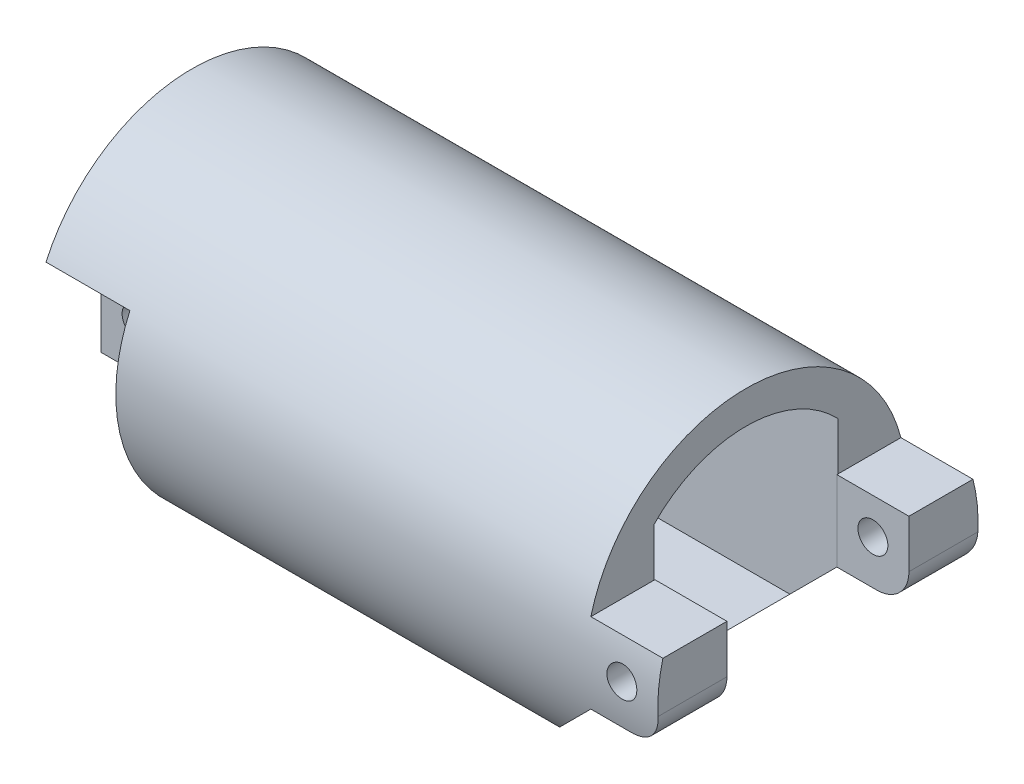
from build123d import *
from build123d.topology import SkipClean

# Parameters (mm, degrees)
SKETCH1_R                = 10
BOSS_EXTRUDE1_DEPTH      = 10
SKETCH4_R                = 1.305
CUT_EXTRUDE3_DEPTH       = 25.5
BOSS_EXTRUDE2_START      = 4.5
BOSS_EXTRUDE2_DEPTH      = 4.5
SKETCH6_R                = 0.935
CUT_EXTRUDE4_DEPTH       = 12.25
SKETCH7_W                = 11.364916732
SKETCH7_H                = 5
BOSS_EXTRUDE3_DEPTH      = 4.5
SKETCH8_R                = 0.935
CUT_EXTRUDE5_DEPTH       = 7.25
BOSS_EXTRUDE4_DEPTH      = 4.5
CUT_EXTRUDE6_START       = -0.75
CUT_EXTRUDE6_DEPTH       = 0.75
SKETCH12_W               = 5.25
SKETCH12_H               = 4
CUT_EXTRUDE7_DEPTH       = 1.6
CUT_EXTRUDE8_DEPTH       = 15.8
FILLET1_R                = 2
CUT_EXTRUDE9_DEPTH       = 10.8
SKETCH15_W               = 11.364916732
SKETCH15_H               = 6.6
CUT_EXTRUDE10_DEPTH      = 1.6
CUT_EXTRUDE11_DEPTH      = 15
BOSS_EXTRUDE5_REACH      = 35.438
SKETCH17_R               = 10
SKETCH17_R_2             = 1.305
CUT_EXTRUDE12_DEPTH      = 14
SCALE1_SCALE             = 0.8
BOSS_EXTRUDE6_DEPTH      = 7
BOSS_EXTRUDE6_DEPTH_BACK = 2
SKETCH20_R               = 8
SKETCH20_R_2             = 1.044


with BuildPart() as part:
    # Sketch1 → Boss-Extrude1 (new, symmetric)
    with BuildSketch(Plane(origin=(0, 0, 0), x_dir=(0, 0, -1), z_dir=(1, 0, 0))):
        Circle(SKETCH1_R)
    extrude(amount=BOSS_EXTRUDE1_DEPTH, both=True)

    # Sketch4 → Cut-Extrude3 (cut, symmetric)
    with BuildSketch(Plane(origin=(0, -0.76336978, 0), x_dir=(0, 0, -1), z_dir=(1, 0, 0))):
        with Locations((0, -6.913267104)):
            Circle(SKETCH4_R)
    extrude(amount=CUT_EXTRUDE3_DEPTH, both=True, mode=Mode.SUBTRACT)

    # Sketch5 → Boss-Extrude2 (add)
    with BuildSketch(Plane(origin=(10, 0, 0), x_dir=(0, 0, -1), z_dir=(1, 0, 0)).offset(BOSS_EXTRUDE2_START)):
        with BuildLine():
            Line((-9.682458366, -2.5), (-5.682458366, -2.5))
            Line((-5.682458366, -2.5), (-5.682458366, 2.5))
            Line((-5.682458366, 2.5), (-9.682458366, 2.5))
            ThreePointArc((-9.682458366, 2.5), (-10, 0), (-9.682458366, -2.5))
        make_face()
    boss_extrude2 = extrude(amount=-BOSS_EXTRUDE2_DEPTH)

    # Mirror1: Boss-Extrude2 across plane
    add(boss_extrude2.mirror(Plane.XY))

    # Sketch6 → Cut-Extrude4 (cut, symmetric)
    with SkipClean():  # the faces are left unmerged after this step: merging them gives an invalid solid
        with BuildSketch(Plane.XY):
            with Locations((12.25, 0.25)):
                Circle(SKETCH6_R)
        extrude(amount=CUT_EXTRUDE4_DEPTH, both=True, mode=Mode.SUBTRACT)

    # Sketch7 → Boss-Extrude3 (add)
    with SkipClean():  # the faces are left unmerged after this step: merging them gives an invalid solid
        with BuildSketch(Plane.ZY.offset(10)):
            Rectangle(SKETCH7_W, SKETCH7_H)
        extrude(amount=BOSS_EXTRUDE3_DEPTH)

    # Sketch8 → Cut-Extrude5 (cut, symmetric)
    with SkipClean():  # the faces are left unmerged after this step: merging them gives an invalid solid
        with BuildSketch(Plane.XY):
            with Locations((-12.25, 0.25)):
                Circle(SKETCH8_R)
        extrude(amount=CUT_EXTRUDE5_DEPTH, both=True, mode=Mode.SUBTRACT)

    # Sketch10 → Boss-Extrude4 (add)
    with SkipClean():  # the faces are left unmerged after this step: merging them gives an invalid solid
        with BuildSketch(Plane.ZY.offset(10)):
            with BuildLine():
                Line((9.682458366, 2.5), (-9.682458366, 2.5))
                ThreePointArc((-9.682458366, 2.5), (0, 10), (9.682458366, 2.5))
            make_face()
        extrude(amount=BOSS_EXTRUDE4_DEPTH)

    # Cut-Extrude6: read off the stored shape, not the designer's step
    # Cut-Extrude6 outline → Cut-Extrude6 (cut)
    with SkipClean():  # the faces are left unmerged after this step: merging them gives an invalid solid
        with BuildSketch(Plane.ZY.offset(10).offset(CUT_EXTRUDE6_START)):
            with BuildLine():
                ThreePointArc((-9.682458366, 2.5), (-9.369942303, -3.493448331), (-5.682458366, -8.228588392))
                Line((-5.682458366, -8.228588392), (-5.682458366, 2.5))
                Line((-5.682458366, 2.5), (-9.682458366, 2.5))
            make_face()
            with BuildLine():
                Line((5.682458366, 2.5), (5.682458366, -8.228588392))
                ThreePointArc((5.682458366, -8.228588392), (9.369942303, -3.493448331), (9.682458366, 2.5))
                Line((9.682458366, 2.5), (5.682458366, 2.5))
            make_face()
        extrude(amount=CUT_EXTRUDE6_DEPTH, mode=Mode.SUBTRACT)

    # Sketch12 → Cut-Extrude7 (cut)
    with SkipClean():  # the faces are left unmerged after this step: merging them gives an invalid solid
        with BuildSketch(Plane.XZ.offset(-2.5)):
            with Locations((-11.875, -7.682458366)):
                Rectangle(SKETCH12_W, SKETCH12_H)
            with Locations((-11.875, 7.682458366)):
                Rectangle(SKETCH12_W, SKETCH12_H)
        extrude(amount=-CUT_EXTRUDE7_DEPTH, mode=Mode.SUBTRACT)

    # Sketch13 → Cut-Extrude8 (cut, symmetric)
    with SkipClean():  # the faces are left unmerged after this step: merging them gives an invalid solid
        with BuildSketch(Plane.XY):
            Polygon((-10, -8.228588392), (-10, -2.5), (-2.5, -10), (-10, -10), align=None)
        extrude(amount=CUT_EXTRUDE8_DEPTH, both=True, mode=Mode.SUBTRACT)

    # Fillet1
    fillet1_edges = [part.edges().sort_by_distance(p)[0] for p in [
        (14.5, -2.5, 7.682458366),
        (14.5, -2.5, -7.682458366),
    ]]
    fillet(fillet1_edges, radius=FILLET1_R)

    # Sketch14 → Cut-Extrude9 (cut, symmetric)
    with SkipClean():  # the faces are left unmerged after this step: merging them gives an invalid solid
        with BuildSketch(Plane.XY):
            Polygon((10, -10), (10, -2.5), (2.5, -10), align=None)
        extrude(amount=CUT_EXTRUDE9_DEPTH, both=True, mode=Mode.SUBTRACT)

    # Sketch15 → Cut-Extrude10 (cut)
    with SkipClean():  # the faces are left unmerged after this step: merging them gives an invalid solid
        with BuildSketch(Plane(origin=(10, 0, 0), x_dir=(0, 0, -1), z_dir=(1, 0, 0))):
            with Locations((0, -0.8)):
                Rectangle(SKETCH15_W, SKETCH15_H)
        extrude(amount=-CUT_EXTRUDE10_DEPTH, mode=Mode.SUBTRACT)

    # Sketch16 → Cut-Extrude11 (cut)
    with SkipClean():  # the faces are left unmerged after this step: merging them gives an invalid solid
        with BuildSketch(Plane(origin=(10, 0, 0), x_dir=(0, 0, -1), z_dir=(1, 0, 0))):
            with BuildLine():
                Line((-5.75, 5.5), (-5.75, -5.5))
                Line((-5.75, -5.5), (5.75, -5.5))
                Line((5.75, -5.5), (5.75, 5.5))
                ThreePointArc((5.75, 5.5), (0, 7.956915231), (-5.75, 5.5))
            make_face()
        extrude(amount=-CUT_EXTRUDE11_DEPTH, mode=Mode.SUBTRACT)


with BuildPart() as body_2:
    # Split1: the piece on the far side of the plane
    add(part.part)
    split(bisect_by=Plane(origin=(0, 0, 0), x_dir=(0, 0, 1), z_dir=(1, 0, 0)), keep=Keep.BOTTOM)


with BuildPart() as part_1:
    add(part.part)

    # Split1
    split(bisect_by=Plane(origin=(0, 0, 0), x_dir=(0, 0, 1), z_dir=(1, 0, 0)), keep=Keep.TOP)


with BuildPart() as part_2:
    # Body-Move/Copy1: moved
    add(part_1.part.moved(Location((15.8, 0, 0))))


    # Sketch17 → Boss-Extrude5 (add, up to next)
    with BuildSketch(Plane.ZY.offset(-15.8), mode=Mode.PRIVATE) as boss_extrude5_sk1:
        with Locations(Location((0, 0, 0), (0, 0, 357.134016017))):
            Circle(SKETCH17_R)
        with Locations(Location((0, -7.676636884, 0), (0, 0, 180))):
            Circle(SKETCH17_R_2, mode=Mode.SUBTRACT)
        with BuildLine():
            Line((-5.75, -5.5), (5.75, -5.5))
            Line((5.75, -5.5), (5.75, 5.5))
            ThreePointArc((5.75, 5.5), (0, 7.956915231), (-5.75, 5.5))
            Line((-5.75, 5.5), (-5.75, -5.5))
        make_face(mode=Mode.SUBTRACT)
    boss_extrude5_tool1 = extrude(boss_extrude5_sk1.sketch, amount=BOSS_EXTRUDE5_REACH, mode=Mode.PRIVATE) - body_2.part
    add(boss_extrude5_tool1.solids().sort_by_distance((15.8, 0.485858, -9.705003))[0])


with BuildPart() as body_2_1:
    # Body-Move/Copy2: moved
    add(body_2.part.moved(Location((9.26, 0, 0))))

    # Combine4: union part
    add(part_2.part)

    # Sketch18 → Cut-Extrude12 (cut)
    with SkipClean():  # the faces are left unmerged after this step: merging them gives an invalid solid
        with BuildSketch(Plane.ZY.offset(5.24)):
            with BuildLine():
                Line((-5.75, 5.5), (-5.75, 4.1))
                Line((-5.75, 4.1), (5.75, 4.1))
                Line((5.75, 4.1), (5.75, 5.5))
                ThreePointArc((5.75, 5.5), (0, 7.956915231), (-5.75, 5.5))
            make_face()
        extrude(amount=-CUT_EXTRUDE12_DEPTH, mode=Mode.SUBTRACT)


with BuildPart() as body_2_2:
    # Scale1: scaled about (10.157754057, 0.26372377, 1.86e-07)
    add(body_2_1.part.scale(SCALE1_SCALE).moved(Location((2.031550811, 0.052744754, 3.7e-08))))


with BuildPart() as body_2_2_1:
    # Split2: the piece on the far side of the plane
    add(body_2_2.part)
    split(bisect_by=Plane(origin=(10, 0, 0), x_dir=(0, 0, 1), z_dir=(1, 0, 0)), keep=Keep.BOTTOM)


with BuildPart() as body_2_3:
    add(body_2_2.part)

    # Split2
    split(bisect_by=Plane(origin=(10, 0, 0), x_dir=(0, 0, 1), z_dir=(1, 0, 0)), keep=Keep.TOP)



with BuildPart() as body_2_2_2:
    # Body-Move/Copy3: read off the stored shape, not the designer's step
    # Body-Move/Copy3: moved
    add(body_2_2_1.part.moved(Location((-2.8395551, 0, 0))))


with BuildPart() as body_2_4:
    with SkipClean():  # the faces are left unmerged after this step: merging them gives an invalid solid
        add(body_2_3.part)

        add(body_2_2_2.part)  # Boss-Extrude6 merges body 2 2
        # Sketch20 → Boss-Extrude6 (add, two sides: drawn at the far end of the back side and taken through both)
        with BuildSketch(Plane(origin=(7.160444914, 0, 0), x_dir=(0, 0, -1), z_dir=(1, 0, 0)).offset(-BOSS_EXTRUDE6_DEPTH_BACK)):
            with Locations(Location((1.2156e-05, 0.052738333, 0), (0, 0, 182.865983983))):
                Circle(SKETCH20_R)
            with Locations((1.2156e-05, -6.088571173)):
                Circle(SKETCH20_R_2, mode=Mode.SUBTRACT)
            with BuildLine():
                Line((-4.599987844, -4.347261667), (4.600012156, -4.347261667))
                Line((4.600012156, -4.347261667), (4.600012156, 4.452738333))
                ThreePointArc((4.600012156, 4.452738333), (1.2156e-05, 6.418270519), (-4.599987844, 4.452738333))
                Line((-4.599987844, 4.452738333), (-4.599987844, -4.347261667))
            make_face(mode=Mode.SUBTRACT)
        extrude(amount=BOSS_EXTRUDE6_DEPTH + BOSS_EXTRUDE6_DEPTH_BACK)


solid = body_2_4.part
